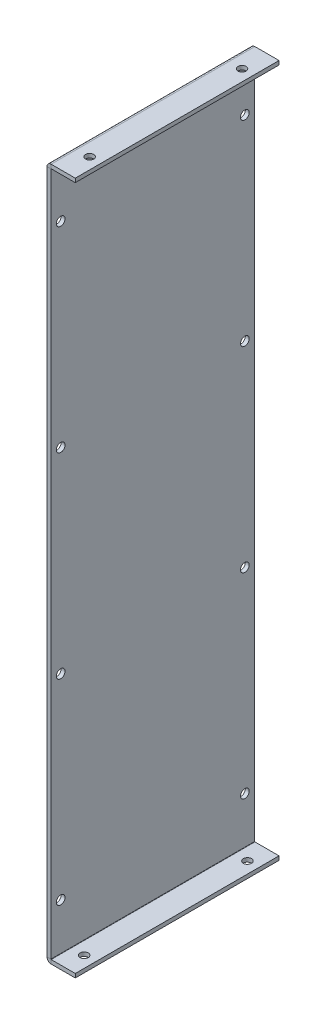
from build123d import *

# Parameters (mm, degrees)
BASE_FLANGE2_DEPTH = 118.872
SKETCH3_R          = 2.54
CUT_EXTRUDE1_DEPTH = 2.286
SKETCH4_R          = 2.3876
CUT_EXTRUDE3_DEPTH = 2.286
SKETCH7_R          = 2.38125
CUT_EXTRUDE4_DEPTH = 2.286


# Sheet-metal steps are written as plain solids
with BuildPart() as part:
    # Sketch2 → Base-Flange2 (new body)
    with BuildSketch(Plane.XY):
        with BuildLine():
            Line((16.51, 404.114), (2.4384, 404.114))
            ThreePointArc((2.4384, 404.114), (0.714190825, 403.399809175), (0, 401.6756))
            Line((0, 401.6756), (0, 2.4384))
            ThreePointArc((0, 2.4384), (0.714190825, 0.714190825), (2.4384, 0))
            Line((2.4384, 0), (16.51, 0))
            Line((16.51, 0), (16.51, 2.286))
            Line((16.51, 2.286), (2.4384, 2.286))
            ThreePointArc((2.4384, 2.286), (2.330636927, 2.330636927), (2.286, 2.4384))
            Line((2.286, 2.4384), (2.286, 401.6756))
            ThreePointArc((2.286, 401.6756), (2.330636927, 401.783363073), (2.4384, 401.828))
            Line((2.4384, 401.828), (16.51, 401.828))
            Line((16.51, 401.828), (16.51, 404.114))
        make_face()
    extrude(amount=BASE_FLANGE2_DEPTH)

    # Sketch3 → Cut-Extrude1 (cut)
    with BuildSketch(Plane.ZY):
        with Locations((5.715, 258.064)):
            Circle(SKETCH3_R)
        with Locations((113.157, 258.064)):
            Circle(SKETCH3_R)
        with Locations((5.715, 143.764)):
            Circle(SKETCH3_R)
        with Locations((113.157, 143.764)):
            Circle(SKETCH3_R)
        with Locations((5.715, 372.364)):
            Circle(SKETCH3_R)
        with Locations((113.157, 372.364)):
            Circle(SKETCH3_R)
        with Locations((113.157, 29.464)):
            Circle(SKETCH3_R)
        with Locations((5.715, 29.464)):
            Circle(SKETCH3_R)
    extrude(amount=-CUT_EXTRUDE1_DEPTH, mode=Mode.SUBTRACT)

    # Sketch4 → Cut-Extrude3 (cut)
    with BuildSketch(Plane.XZ):
        with Locations(Location((9.906, 107.061, 0), (0, 0, 270))):
            Circle(SKETCH4_R)
        with Locations(Location((9.906, 11.811, 0), (0, 0, 270))):
            Circle(SKETCH4_R)
    extrude(amount=-CUT_EXTRUDE3_DEPTH, mode=Mode.SUBTRACT)

    # Sketch7 → Cut-Extrude4 (cut)
    with BuildSketch(Plane(origin=(0, 404.114, 0), x_dir=(-1, 0, 0), z_dir=(0, 1, 0))):
        with Locations(Location((-9.906, 103.886, 0), (0, 0, 90))):
            Circle(SKETCH7_R)
        with Locations(Location((-9.906, 14.986, 0), (0, 0, 90))):
            Circle(SKETCH7_R)
    extrude(amount=-CUT_EXTRUDE4_DEPTH, mode=Mode.SUBTRACT)


solid = part.part
